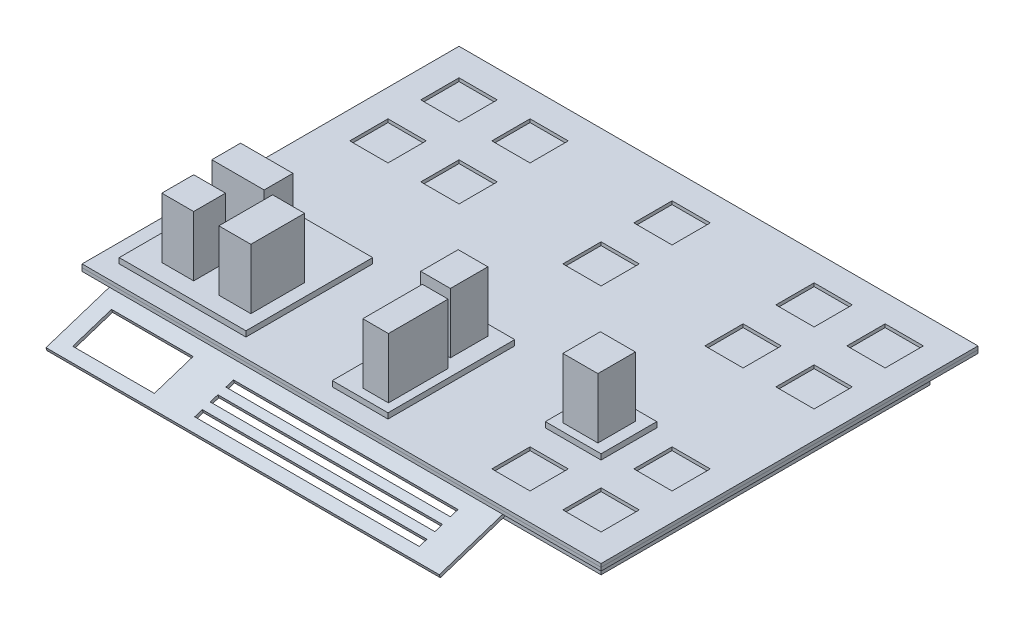
from build123d import *

# Parameters (mm, degrees)
SKETCH2_W             = 475
SKETCH2_H             = 345
SKETCH2_W_2           = 35
SKETCH2_H_2           = 35
BOSS_EXTRUDE1_DEPTH   = 3
SKETCH2_3_W           = 475
SKETCH2_3_H           = 345
BOSS_EXTRUDE2_DEPTH   = 3
SKETCH3_W             = 431
SKETCH3_H             = 301
SKETCH3_W_2           = 425
SKETCH3_H_2           = 295
EXTRUDE_THIN1_DEPTH   = 25
SKETCH4_W             = 360
SKETCH4_H             = 80
SKETCH4_W_2           = 205.548635826
SKETCH4_H_2           = 7.312330471
SKETCH4_W_3           = 74.693903183
SKETCH4_H_3           = 37.312330471
BOSS_EXTRUDE3_DEPTH   = 3
SKETCH5_W             = 31
SKETCH5_H             = 31
BOSS_EXTRUDE4_DEPTH   = 3
BOSS_EXTRUDE4_2_DEPTH = 3
BOSS_EXTRUDE4_3_DEPTH = 3
BOSS_EXTRUDE4_4_DEPTH = 3
BOSS_EXTRUDE4_5_DEPTH = 3
SKETCH5_W_2           = 35
SKETCH5_H_2           = 35
BOSS_EXTRUDE4_6_DEPTH = 3
BOSS_EXTRUDE4_7_DEPTH = 3
SKETCH5_3_W           = 116
SKETCH5_3_H           = 116
SKETCH5_3_W_2         = 51
SKETCH5_3_H_2         = 51
BOSS_EXTRUDE5_DEPTH   = 5
SKETCH6_W             = 29.15932197
SKETCH6_H             = 29.15932197
SKETCH6_W_2           = 47.888889902
SKETCH6_H_2           = 26.355541011
SKETCH6_W_3           = 29.278574595
SKETCH6_H_3           = 49.163565954
SKETCH6_W_4           = 27.192074955
SKETCH6_H_4           = 34.320094604
SKETCH6_W_5           = 23.496064768
SKETCH6_H_5           = 54.583415599
SKETCH6_W_6           = 32.05569658
BOSS_EXTRUDE6_DEPTH   = 55


with BuildPart() as part:
    # Sketch2 → Boss-Extrude1 (new body)
    with BuildSketch(Plane(origin=(0, 0, 0), x_dir=(1, 0, 0), z_dir=(0, 1, 0))):
        with Locations((212.5, 147.5)):
            Rectangle(SKETCH2_W, SKETCH2_H)
        with Locations((82.5, 17.5)):
            Rectangle(SKETCH2_W_2, SKETCH2_H_2, mode=Mode.SUBTRACT)
        with Locations((17.5, 17.5)):
            Rectangle(SKETCH2_W_2, SKETCH2_H_2, mode=Mode.SUBTRACT)
        with Locations((212.5, 17.5)):
            Rectangle(SKETCH2_W_2, SKETCH2_H_2, mode=Mode.SUBTRACT)
        with Locations((342.5, 17.5)):
            Rectangle(SKETCH2_W_2, SKETCH2_H_2, mode=Mode.SUBTRACT)
        with Locations((407.5, 17.5)):
            Rectangle(SKETCH2_W_2, SKETCH2_H_2, mode=Mode.SUBTRACT)
        with Locations((82.5, 82.5)):
            Rectangle(SKETCH2_W_2, SKETCH2_H_2, mode=Mode.SUBTRACT)
        with Locations((212.5, 82.5)):
            Rectangle(SKETCH2_W_2, SKETCH2_H_2, mode=Mode.SUBTRACT)
        with Locations((342.5, 82.5)):
            Rectangle(SKETCH2_W_2, SKETCH2_H_2, mode=Mode.SUBTRACT)
        with Locations((407.5, 82.5)):
            Rectangle(SKETCH2_W_2, SKETCH2_H_2, mode=Mode.SUBTRACT)
        with Locations((82.5, 212.5)):
            Rectangle(SKETCH2_W_2, SKETCH2_H_2, mode=Mode.SUBTRACT)
        with Locations((212.5, 212.5)):
            Rectangle(SKETCH2_W_2, SKETCH2_H_2, mode=Mode.SUBTRACT)
        with Locations((342.5, 212.5)):
            Rectangle(SKETCH2_W_2, SKETCH2_H_2, mode=Mode.SUBTRACT)
        with Locations((407.5, 212.5)):
            Rectangle(SKETCH2_W_2, SKETCH2_H_2, mode=Mode.SUBTRACT)
        with Locations((82.5, 277.5)):
            Rectangle(SKETCH2_W_2, SKETCH2_H_2, mode=Mode.SUBTRACT)
        with Locations((212.5, 277.5)):
            Rectangle(SKETCH2_W_2, SKETCH2_H_2, mode=Mode.SUBTRACT)
        with Locations((342.5, 277.5)):
            Rectangle(SKETCH2_W_2, SKETCH2_H_2, mode=Mode.SUBTRACT)
        with Locations((407.5, 277.5)):
            Rectangle(SKETCH2_W_2, SKETCH2_H_2, mode=Mode.SUBTRACT)
        with Locations((17.5, 82.5)):
            Rectangle(SKETCH2_W_2, SKETCH2_H_2, mode=Mode.SUBTRACT)
        with Locations((17.5, 212.5)):
            Rectangle(SKETCH2_W_2, SKETCH2_H_2, mode=Mode.SUBTRACT)
        with Locations((17.5, 277.5)):
            Rectangle(SKETCH2_W_2, SKETCH2_H_2, mode=Mode.SUBTRACT)
    extrude(amount=BOSS_EXTRUDE1_DEPTH)


with BuildPart() as body_2:
    # Sketch2<3> → Boss-Extrude2 (new body)
    with BuildSketch(Plane(origin=(0, 0, 0), x_dir=(1, 0, 0), z_dir=(0, 1, 0))):
        with Locations((212.5, 147.5)):
            Rectangle(SKETCH2_3_W, SKETCH2_3_H)
    extrude(amount=-BOSS_EXTRUDE2_DEPTH)


with BuildPart() as body_3:
    # Sketch3 → Extrude-Thin1 (new body)
    with BuildSketch(Plane.XZ.offset(3)):
        with Locations((212.5, -147.5)):
            Rectangle(SKETCH3_W, SKETCH3_H)
        with Locations((212.5, -147.5)):
            Rectangle(SKETCH3_W_2, SKETCH3_H_2, mode=Mode.SUBTRACT)
    extrude(amount=EXTRUDE_THIN1_DEPTH)


with BuildPart() as body_4:
    # Sketch4 → Boss-Extrude3 (new body)
    with BuildSketch(Plane(origin=(0, -3.927050983, 5.853169549), x_dir=(1, 0, 0), z_dir=(0, 0.9510565162951554, 0.30901699437494157))):
        with Locations((177, -37)):
            Rectangle(SKETCH4_W, SKETCH4_H)
        with Locations((225.880765032, -47.869655614)):
            Rectangle(SKETCH4_W_2, SKETCH4_H_2, mode=Mode.SUBTRACT)
        with Locations((225.880765032, -62.869655614)):
            Rectangle(SKETCH4_W_2, SKETCH4_H_2, mode=Mode.SUBTRACT)
        with Locations((225.880765032, -32.869655614)):
            Rectangle(SKETCH4_W_2, SKETCH4_H_2, mode=Mode.SUBTRACT)
        with Locations((48.787220683, -47.785690822)):
            Rectangle(SKETCH4_W_3, SKETCH4_H_3, mode=Mode.SUBTRACT)
    extrude(amount=BOSS_EXTRUDE3_DEPTH)


with BuildPart() as body_5:
    # Sketch5 → Boss-Extrude4 (new body)
    with BuildSketch(Plane(origin=(0, 3, 0), x_dir=(1, 0, 0), z_dir=(0, 1, 0))):
        with Locations((17.5, 82.5)):
            Rectangle(SKETCH5_W, SKETCH5_H)
    extrude(amount=-BOSS_EXTRUDE4_DEPTH)


with BuildPart() as body_6:
    # Sketch5 → Boss-Extrude4 2 (new body)
    with BuildSketch(Plane(origin=(0, 3, 0), x_dir=(1, 0, 0), z_dir=(0, 1, 0))):
        with Locations((82.5, 82.5)):
            Rectangle(SKETCH5_W, SKETCH5_H)
    extrude(amount=-BOSS_EXTRUDE4_2_DEPTH)


with BuildPart() as body_7:
    # Sketch5 → Boss-Extrude4 3 (new body)
    with BuildSketch(Plane(origin=(0, 3, 0), x_dir=(1, 0, 0), z_dir=(0, 1, 0))):
        with Locations((17.5, 17.5)):
            Rectangle(SKETCH5_W, SKETCH5_H)
    extrude(amount=-BOSS_EXTRUDE4_3_DEPTH)


    add(body_5.part)  # Boss-Extrude5 merges body 5

    add(body_6.part)  # Boss-Extrude5 merges body 6


with BuildPart() as body_8:
    # Sketch5 → Boss-Extrude4 4 (new body)
    with BuildSketch(Plane(origin=(0, 3, 0), x_dir=(1, 0, 0), z_dir=(0, 1, 0))):
        with Locations((82.5, 17.5)):
            Rectangle(SKETCH5_W, SKETCH5_H)
    extrude(amount=-BOSS_EXTRUDE4_4_DEPTH)


with BuildPart() as body_9:
    # Sketch5 → Boss-Extrude4 5 (new body)
    with BuildSketch(Plane(origin=(0, 3, 0), x_dir=(1, 0, 0), z_dir=(0, 1, 0))):
        with Locations((212.5, 82.5)):
            Rectangle(SKETCH5_W, SKETCH5_H)
    extrude(amount=-BOSS_EXTRUDE4_5_DEPTH)


with BuildPart() as body_10:
    # Sketch5 → Boss-Extrude4 6 (new body)
    with BuildSketch(Plane(origin=(0, 3, 0), x_dir=(1, 0, 0), z_dir=(0, 1, 0))):
        with Locations((212.5, 17.5)):
            Rectangle(SKETCH5_W_2, SKETCH5_H_2)
    extrude(amount=-BOSS_EXTRUDE4_6_DEPTH)


with BuildPart() as body_11:
    # Sketch5 → Boss-Extrude4 7 (new body)
    with BuildSketch(Plane(origin=(0, 3, 0), x_dir=(1, 0, 0), z_dir=(0, 1, 0))):
        with Locations((342.5, 82.5)):
            Rectangle(SKETCH5_W, SKETCH5_H)
    extrude(amount=-BOSS_EXTRUDE4_7_DEPTH)


with BuildPart() as body_7_1:
    add(body_7.part)

    add(body_8.part)  # Boss-Extrude5 merges body 8

    add(body_9.part)  # Boss-Extrude5 merges body 9

    add(body_10.part)  # Boss-Extrude5 merges body 10

    add(body_11.part)  # Boss-Extrude5 merges body 11
    # Sketch5<3> → Boss-Extrude5 (add)
    with BuildSketch(Plane(origin=(0, 3, 0), x_dir=(1, 0, 0), z_dir=(0, 1, 0))):
        with Locations((50, 50)):
            Rectangle(SKETCH5_3_W, SKETCH5_3_H)
        with Locations((212.5, 50)):
            Rectangle(SKETCH5_3_W_2, SKETCH5_3_H)
        with Locations((342.5, 82.5)):
            Rectangle(SKETCH5_3_W_2, SKETCH5_3_H_2)
    extrude(amount=BOSS_EXTRUDE5_DEPTH)

    # Sketch6 → Boss-Extrude6 (add)
    with BuildSketch(Plane(origin=(0, 8, 0), x_dir=(1, 0, 0), z_dir=(0, 1, 0))):
        with Locations((29.973859589, 22.164289031)):
            Rectangle(SKETCH6_W, SKETCH6_H)
        with Locations((35.7494928, 70.108943425)):
            Rectangle(SKETCH6_W_2, SKETCH6_H_2)
        with Locations((82.064559109, 32.349389942)):
            Rectangle(SKETCH6_W_3, SKETCH6_H_3)
        with Locations((209.414489577, 81.247489099)):
            Rectangle(SKETCH6_W_4, SKETCH6_H_4)
        with Locations((218.654515047, 27.2917078)):
            Rectangle(SKETCH6_W_5, SKETCH6_H_5)
        with Locations((341.989503146, 81.247489099)):
            Rectangle(SKETCH6_W_6, SKETCH6_H_4)
    extrude(amount=BOSS_EXTRUDE6_DEPTH)


solid = Compound([part.part, body_2.part, body_3.part, body_4.part, body_7_1.part])
